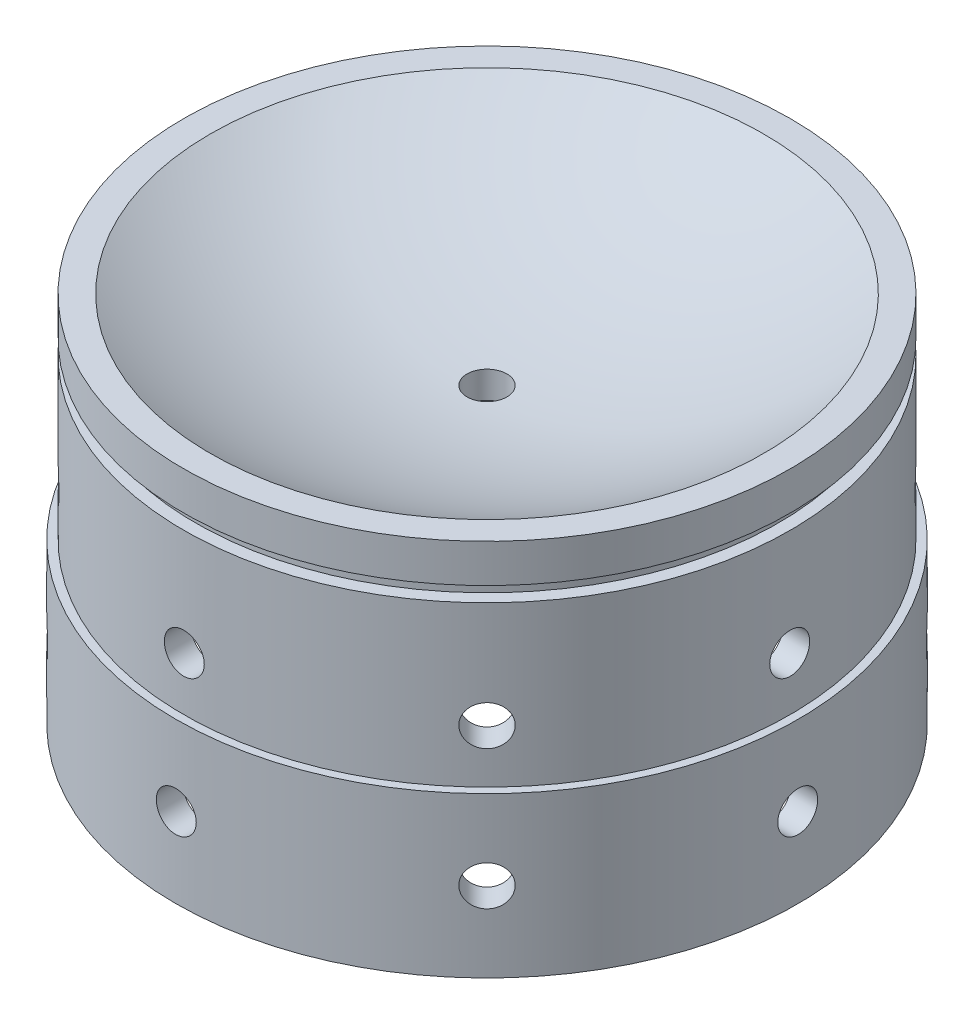
from build123d import *

# Parameters (mm, degrees)
MAIN_LINE_HOLE_REACH      = 124.767
MAIN_LINE_HOLE_END_RADIUS = 123.994333333
SKETCH10_R                = 4.7625
CHAMFER1_SIZE             = 2.54
CIRPATTERN1_COUNT         = 8


with BuildPart() as part:
    # Sketch1 → Revolve1 (revolve)
    with BuildSketch(Plane.XY, mode=Mode.PRIVATE) as revolve1_sk:
        with BuildLine():
            Line((0, 6.35), (0, 0))
            Line((0, 0), (66.04, 0))
            Line((66.04, 0), (72.39, 0))
            Line((72.39, 0), (72.39, 12.7))
            Line((72.39, 12.7), (69.469, 12.7))
            Line((69.469, 12.7), (69.469, 16.256))
            Line((69.469, 16.256), (72.39, 16.256))
            Line((72.39, 16.256), (72.39, 25.4))
            Line((72.39, 25.4), (66.04, 25.4))
            ThreePointArc((66.04, 25.4), (34.366350184, 11.207652694), (0, 6.35))
        make_face()
        Polygon((72.39, 0), (66.04, 0), (66.04, -25.4), (67.945, -25.4), (72.39, -25.4), align=None)
        Polygon((72.39, 0), (66.04, 0), (66.04, -25.4), (67.945, -25.4), (72.39, -25.4), align=None)
        Polygon((74.295, -25.4), (72.39, -25.4), (67.945, -25.4), (67.945, -63.5), (74.295, -63.5), align=None)
    revolve(revolve1_sk.sketch.rotate(Axis((0, 0, 0), (0, 1, 0)), 90), axis=Axis((0, 0, 0), (0, 1, 0)))

    # Sketch8 → 3/8 (0.375) Diameter Hole1 (revolve, cut)
    with BuildSketch(Plane(origin=(72.39, -12.7, 0), x_dir=(0, 0, -1), z_dir=(0, 1, 0))):
        Polygon((0, 0), (0, 75.250598698), (4.7625, 72.389), (4.7625, 0), align=None)
    f_3_8_0_375_diameter_hole1 = revolve(axis=Axis((78.74, -12.7, 0), (-1, 0, 0)), mode=Mode.SUBTRACT)

    # Sketch9 → 3/8 (0.375) Diameter Hole2 (revolve, cut)
    with BuildSketch(Plane(origin=(74.295, -44.45, 0), x_dir=(0, 0, -1), z_dir=(0, 1, 0))):
        Polygon((0, 0), (0, 77.155598698), (4.7625, 74.294), (4.7625, 0), align=None)
    f_3_8_0_375_diameter_hole2 = revolve(axis=Axis((80.645, -44.45, 0), (-1, 0, 0)), mode=Mode.SUBTRACT)

    # Main Line Hole: up to this sphere (the profile starts outside it)
    main_line_hole_end = Location((0, 130.344333333, 0)) * Sphere(MAIN_LINE_HOLE_END_RADIUS, mode=Mode.PRIVATE)
    # Sketch10 → Main Line Hole (cut, up to the surface)
    with BuildSketch(Plane.XZ, mode=Mode.PRIVATE) as main_line_hole_sk1:
        with Locations(Location((0, 0, 0), (0, 0, 270))):
            Circle(SKETCH10_R)
    main_line_hole_tool1 = extrude(main_line_hole_sk1.sketch, amount=-MAIN_LINE_HOLE_REACH, mode=Mode.PRIVATE) - main_line_hole_end
    add(main_line_hole_tool1.solids().sort_by_distance((0, 0, 0))[0], mode=Mode.SUBTRACT)

    # Chamfer1
    # the kernel refuses this chamfer: 2.54 mm, written as the material it adds along each edge
    with BuildSketch(Plane(origin=(0, -25.4, 0), x_dir=(0, 0, -1), z_dir=(1, 0, 0))) as chamfer1_piece_1_section:
        Polygon((67.945 - CHAMFER1_SIZE, 0), (67.945, -CHAMFER1_SIZE), (67.945, 0), align=None)
    chamfer1_piece_1 = revolve(axis=Axis((0, -25.4, 0), (0, 1, 0)), mode=Mode.PRIVATE)
    chamfer1_piece_1 = chamfer1_piece_1 - Plane(origin=(0, -26.944579126, 0), x_dir=(0, 0, -1), z_dir=(0, -1, 0)) * Cylinder(66.04, 272, mode=Mode.PRIVATE)
    add(chamfer1_piece_1)

    # CirPattern1: 3/8 (0.375) Diameter Hole1, 3/8 (0.375) Diameter Hole2 ×8 about axis
    cirpattern1_axis = Axis((0, 0, 0), (0, -1, 0))
    add([f_3_8_0_375_diameter_hole1.rotate(cirpattern1_axis, i * 360 / CIRPATTERN1_COUNT) for i in range(1, CIRPATTERN1_COUNT)], mode=Mode.SUBTRACT)
    add([f_3_8_0_375_diameter_hole2.rotate(cirpattern1_axis, i * 360 / CIRPATTERN1_COUNT) for i in range(1, CIRPATTERN1_COUNT)], mode=Mode.SUBTRACT)


solid = part.part
